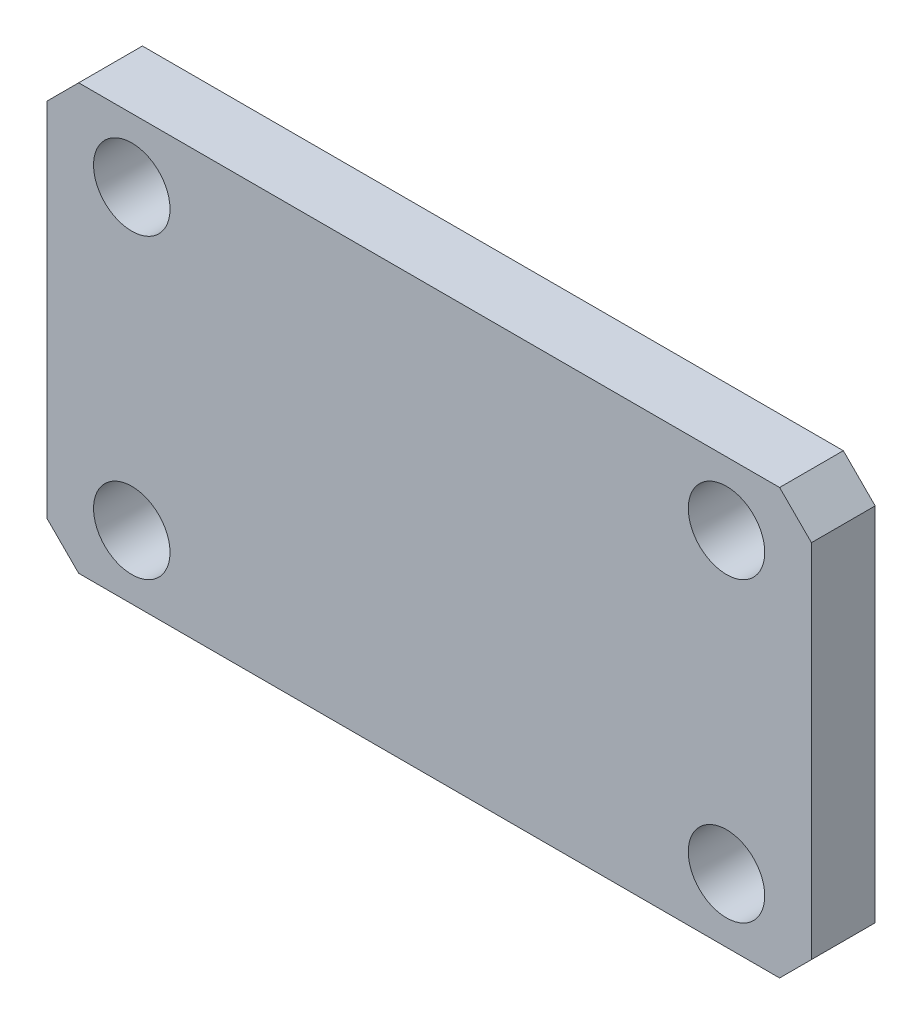
from build123d import *

# Parameters (mm, degrees)
SKETCH1_W                = 36
SKETCH1_H                = 20
BOSS_EXTRUDE1_DEPTH      = 3
M3_CLEARANCE_HOLE1_D     = 3.6
M3_CLEARANCE_HOLE1_DEPTH = 10
M3_CLEARANCE_HOLE1_TIP   = 1.081549114
CHAMFER1_SIZE            = 1.5
SKETCH4_W                = 20
SKETCH4_H                = 12
CUT_EXTRUDE1_DEPTH       = 0.5
SKETCH5_W                = 18
SKETCH5_H                = 10
BOSS_EXTRUDE2_DEPTH      = 1


with BuildPart() as part:
    # Sketch1 → Boss-Extrude1 (new body)
    with BuildSketch(Plane.XY):
        with Locations((18, 10)):
            Rectangle(SKETCH1_W, SKETCH1_H)
    extrude(amount=BOSS_EXTRUDE1_DEPTH)

    # M3 Clearance Hole1
    with Locations(Plane.XY.offset(3)):
        with Locations((4, 17), (32, 17), (32, 3), (4, 3)):
            Hole(M3_CLEARANCE_HOLE1_D / 2, depth=M3_CLEARANCE_HOLE1_DEPTH)
            with Locations((0, 0, -(M3_CLEARANCE_HOLE1_DEPTH + M3_CLEARANCE_HOLE1_TIP / 2))):  # 118° drill point
                Cone(0, M3_CLEARANCE_HOLE1_D / 2, M3_CLEARANCE_HOLE1_TIP, mode=Mode.SUBTRACT)

    # Chamfer1
    chamfer1_edges = [part.edges().sort_by_distance(p)[0] for p in [
        (36, 20, 1.5),
        (36, 0, 1.5),
        (0, 0, 1.5),
        (0, 20, 1.5),
    ]]
    chamfer(chamfer1_edges, length=CHAMFER1_SIZE)

    # Sketch4 → Cut-Extrude1 (cut)
    with BuildSketch(Plane.XY):
        with Locations((18, 10)):
            Rectangle(SKETCH4_W, SKETCH4_H)
    extrude(amount=CUT_EXTRUDE1_DEPTH, mode=Mode.SUBTRACT)


with BuildPart() as body_2:
    # Sketch5 → Boss-Extrude2 (new body)
    with BuildSketch(Plane(origin=(0, 0, 0.5), x_dir=(-1, 0, 0), z_dir=(0, 0, -1))):
        with Locations((-18, 10)):
            Rectangle(SKETCH5_W, SKETCH5_H)
    extrude(amount=BOSS_EXTRUDE2_DEPTH)


solid = Compound([part.part, body_2.part])
